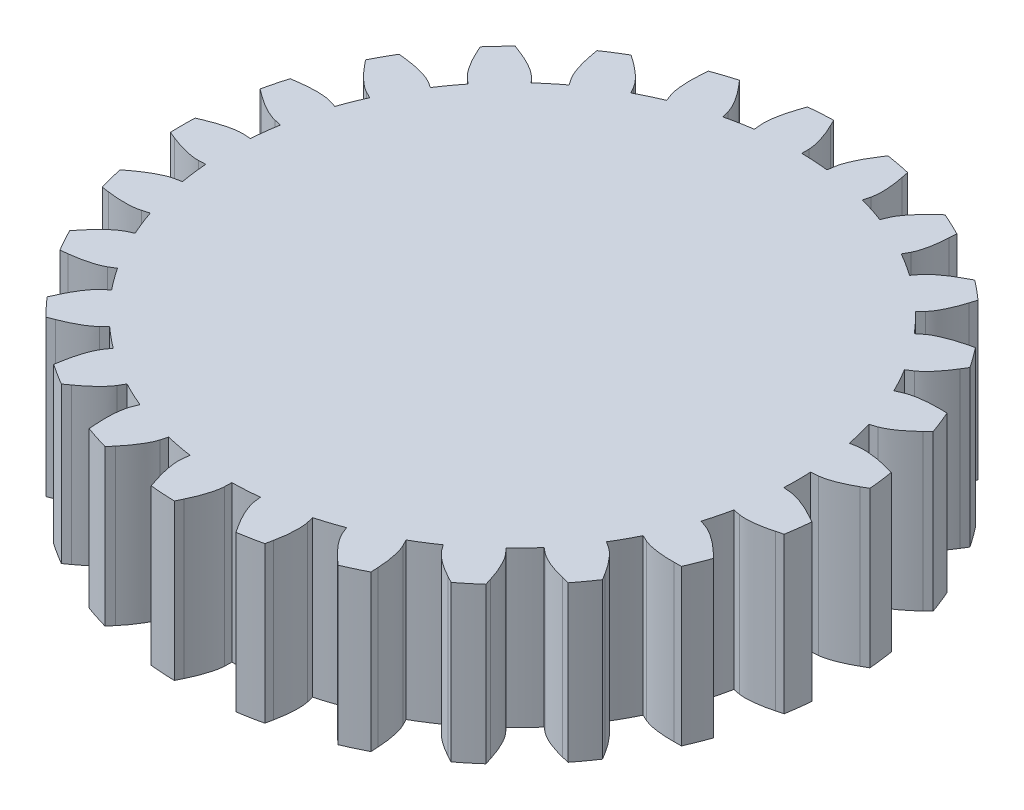
from build123d import *

# Parameters (mm, degrees)
SKETCH5_R           = 27.5
BOSS_EXTRUDE1_DEPTH = 15
BOSS_EXTRUDE2_DEPTH = 15
CIRPATTERN2_COUNT   = 25


with BuildPart() as part:
    # Sketch5 → Boss-Extrude1 (new body)
    with BuildSketch(Plane(origin=(0, 0, 0), x_dir=(1, 0, 0), z_dir=(0, 1, 0))):
        Circle(SKETCH5_R)
    extrude(amount=BOSS_EXTRUDE1_DEPTH)

    # Sketch7 → Boss-Extrude2 (add)
    with BuildSketch(Plane(origin=(0, 0, 0), x_dir=(1, 0, 0), z_dir=(0, 1, 0))):
        with BuildLine():
            Line((0.419103344, 28.187663113), (0.419103344, 27.496806222))
            ThreePointArc((0.419103344, 27.496806222), (-1.735576403, 27.445177619), (-3.879595269, 27.224965391))
            Line((-3.879595269, 27.224965391), (-3.948649553, 27.912867393))
            add(Edge.make_bspline(
                [(-3.408300207, 30.987456132), (-3.481876172, 30.773678284), (-3.581035388, 30.460011842), (-3.692037809, 30.050014355), (-3.75969093, 29.770412754), (-3.815470726, 29.509231584), (-3.860426563, 29.266893651), (-3.895615791, 29.043778597), (-3.922128058, 28.840221794), (-3.960523355, 28.466443269), (-3.970699746, 28.158767672), (-3.948649553, 27.912867393)],
                knots=[0, 0, 0, 0, 0.215964682, 0.314109795, 0.405696755, 0.490725563, 0.569196219, 0.641108722, 0.706463074, 0.765259273, 1, 1, 1, 1], degree=3))
            add(Edge.make_bspline(
                [(-3.408300207, 30.987456132), (-3.260286585, 31.433974048), (-3.186933306, 31.649953493)],
                knots=[0, 0, 0, 1, 1, 1], degree=2))
            ThreePointArc((-3.186933306, 31.649953493), (-1.997366426, 31.747230231), (-0.804987629, 31.799812813))
            add(Edge.make_bspline(
                [(-0.502333335, 31.17028407), (-0.70514336, 31.594730034), (-0.804987629, 31.799812813)],
                knots=[0, 0, 0, 1, 1, 1], degree=2))
            add(Edge.make_bspline(
                [(-0.502333335, 31.17028407), (-0.40254407, 30.967413438), (-0.264853924, 30.668648295), (-0.103340479, 30.275796053), (-0.001177451, 30.006878378), (0.086897185, 29.754747763), (0.161871529, 29.519955197), (0.22474701, 29.303009852), (0.276562653, 29.104381023), (0.361502062, 28.73836206), (0.410160187, 28.434388017), (0.419103344, 28.187663113)],
                knots=[0, 0, 0, 0, 0.215964682, 0.314109795, 0.405696755, 0.490725563, 0.569196219, 0.641108722, 0.706463074, 0.765259273, 1, 1, 1, 1], degree=3))
        make_face()
    boss_extrude2 = extrude(amount=BOSS_EXTRUDE2_DEPTH)

    # CirPattern2: Boss-Extrude2 ×25 about axis
    cirpattern2_axis = Axis((0, 15, 0), (0, 1, 0))
    for i in range(1, CIRPATTERN2_COUNT):
        add(boss_extrude2.rotate(cirpattern2_axis, i * 360 / CIRPATTERN2_COUNT))


solid = part.part
